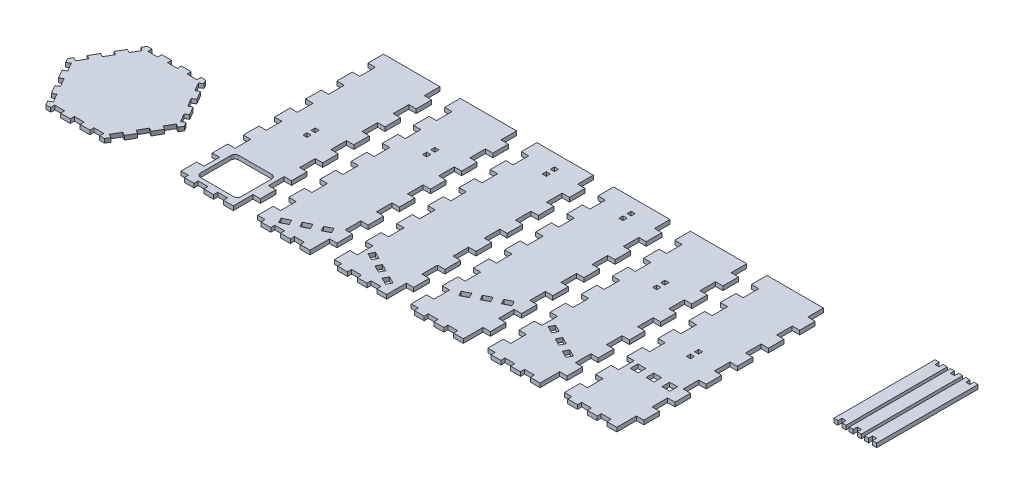
from build123d import *

# Parameters (mm, degrees)
BOSS_EXTRUDE3_DEPTH    = 3.2
SKETCH1_W              = 3.2
SKETCH1_H              = 3.2
BOSS_EXTRUDE3_2_DEPTH  = 3.2
BOSS_EXTRUDE3_3_DEPTH  = 3.2
BOSS_EXTRUDE3_4_DEPTH  = 3.2
BOSS_EXTRUDE3_5_DEPTH  = 3.2
BOSS_EXTRUDE3_6_DEPTH  = 3.2
SKETCH1_W_2            = 6.2
SKETCH1_H_2            = 6
BOSS_EXTRUDE3_7_DEPTH  = 3.2
BOSS_EXTRUDE3_8_DEPTH  = 3.2
BOSS_EXTRUDE3_9_DEPTH  = 3.2
BOSS_EXTRUDE3_10_DEPTH = 3.2


with BuildPart() as part:
    # Sketch1 → Boss-Extrude3 (new body)
    with BuildSketch(Plane(origin=(0, 0, 0), x_dir=(1, 0, 0), z_dir=(0, 1, 0))):
        Polygon((-22.869998863, -39.612), (-19.17495714, -39.612), (-19.17495714, -36.412), (-11.504974284, -36.412), (-11.504974284, -39.612), (-3.834991428, -39.612), (-3.834991428, -36.412), (3.834991428, -36.412), (3.834991428, -39.612), (11.504974284, -39.612), (11.504974284, -36.412), (19.17495714, -36.412), (19.17495714, -39.612), (22.869998863, -39.612), (24.717519725, -36.412), (21.946238432, -34.812), (25.781229861, -28.1696), (28.552511153, -29.7696), (32.387502581, -23.1272), (29.616221289, -21.5272), (33.451212717, -14.8848), (36.222494009, -16.4848), (40.057485437, -9.8424), (37.286204145, -8.2424), (41.121195573, -1.6), (43.892476865, -3.2), (45.739997726, 0), (43.892476865, 3.2), (41.121195573, 1.6), (37.286204145, 8.2424), (40.057485437, 9.8424), (36.222494009, 16.4848), (33.451212717, 14.8848), (29.616221289, 21.5272), (32.387502581, 23.1272), (28.552511153, 29.7696), (25.781229861, 28.1696), (21.946238432, 34.812), (24.717519725, 36.412), (22.869998863, 39.612), (19.17495714, 39.612), (19.17495714, 36.412), (11.504974284, 36.412), (11.504974284, 39.612), (3.834991428, 39.612), (3.834991428, 36.412), (-3.834991428, 36.412), (-3.834991428, 39.612), (-11.504974284, 39.612), (-11.504974284, 36.412), (-19.17495714, 36.412), (-19.17495714, 39.612), (-22.869998863, 39.612), (-24.717519725, 36.412), (-21.946238432, 34.812), (-25.781229861, 28.1696), (-28.552511153, 29.7696), (-32.387502581, 23.1272), (-29.616221289, 21.5272), (-33.451212717, 14.8848), (-36.222494009, 16.4848), (-40.057485437, 9.8424), (-37.286204145, 8.2424), (-41.121195573, 1.6), (-43.892476865, 3.2), (-45.739997726, 0), (-43.892476865, -3.2), (-41.121195573, -1.6), (-37.286204145, -8.2424), (-40.057485437, -9.8424), (-36.222494009, -16.4848), (-33.451212717, -14.8848), (-29.616221289, -21.5272), (-32.387502581, -23.1272), (-28.552511153, -29.7696), (-25.781229861, -28.1696), (-21.946238432, -34.812), (-24.717519725, -36.412), align=None)
    extrude(amount=BOSS_EXTRUDE3_DEPTH)


with BuildPart() as body_2:
    # Sketch1 → Boss-Extrude3 2 (new body)
    with BuildSketch(Plane(origin=(0, 0, 0), x_dir=(1, 0, 0), z_dir=(0, 1, 0))):
        Polygon((80.552757397, -34.879378177), (88.222740254, -34.879378177), (88.222740254, -31.679378177), (95.89272311, -31.679378177), (95.89272311, -34.879378177), (103.562705966, -34.879378177), (103.562705966, -31.679378177), (111.232688822, -31.679378177), (111.232688822, -34.879378177), (118.902671678, -34.879378177), (118.902671678, -19.491070485), (124.645234262, -19.491070485), (124.645234262, -7.302762793), (118.902671678, -7.302762793), (118.902671678, 4.8855449), (124.645234262, 4.8855449), (124.645234262, 17.073852592), (118.902671678, 17.073852592), (118.902671678, 29.262160284), (124.645234262, 29.262160284), (124.645234262, 41.450467977), (118.902671678, 41.450467977), (118.902671678, 53.638775669), (124.645234262, 53.638775669), (124.645234262, 65.827083361), (118.902671678, 65.827083361), (118.902671678, 78.015391054), (124.645234262, 78.015391054), (124.645234262, 90.203698746), (118.902671678, 90.203698746), (118.902671678, 102.392006438), (124.645234262, 102.392006438), (124.645234262, 114.58031413), (118.902671678, 114.58031413), (118.902671678, 126.768621823), (74.810194813, 126.768621823), (74.810194813, 114.58031413), (80.552757397, 114.58031413), (80.552757397, 102.392006438), (74.810194813, 102.392006438), (74.810194813, 90.203698746), (80.552757397, 90.203698746), (80.552757397, 78.015391054), (74.810194813, 78.015391054), (74.810194813, 65.827083361), (80.552757397, 65.827083361), (80.552757397, 53.638775669), (74.810194813, 53.638775669), (74.810194813, 41.450467977), (80.552757397, 41.450467977), (80.552757397, 29.262160284), (74.810194813, 29.262160284), (74.810194813, 17.073852592), (80.552757397, 17.073852592), (80.552757397, 4.8855449), (74.810194813, 4.8855449), (74.810194813, -7.302762793), (80.552757397, -7.302762793), (80.552757397, -19.491070485), (74.810194813, -19.491070485), (74.810194813, -31.679378177), (80.552757397, -31.679378177), align=None)
        with BuildLine():
            Line((86.752757397, 1.520621823), (112.702671678, 1.520621823))
            ThreePointArc((112.702671678, 1.520621823), (114.823992022, 0.641942166), (115.702671678, -1.479378177))
            Line((115.702671678, -1.479378177), (115.702671678, -25.479378177))
            ThreePointArc((115.702671678, -25.479378177), (114.823992022, -27.600698521), (112.702671678, -28.479378177))
            Line((112.702671678, -28.479378177), (86.752757397, -28.479378177))
            ThreePointArc((86.752757397, -28.479378177), (84.631437054, -27.600698521), (83.752757397, -25.479378177))
            Line((83.752757397, -25.479378177), (83.752757397, -1.479378177))
            ThreePointArc((83.752757397, -1.479378177), (84.631437054, 0.641942166), (86.752757397, 1.520621823))
        make_face(mode=Mode.SUBTRACT)
        with Locations((99.727714538, 41.960621823)):
            Rectangle(SKETCH1_W, SKETCH1_H, mode=Mode.SUBTRACT)
        with Locations((99.727714538, 48.360621823)):
            Rectangle(SKETCH1_W, SKETCH1_H, mode=Mode.SUBTRACT)
    extrude(amount=BOSS_EXTRUDE3_2_DEPTH)


with BuildPart() as body_3:
    # Sketch1 → Boss-Extrude3 3 (new body)
    with BuildSketch(Plane(origin=(0, 0, 0), x_dir=(1, 0, 0), z_dir=(0, 1, 0))):
        Polygon((140.552757397, -34.879378177), (148.222740254, -34.879378177), (148.222740254, -31.679378177), (155.89272311, -31.679378177), (155.89272311, -34.879378177), (163.562705966, -34.879378177), (163.562705966, -31.679378177), (171.232688822, -31.679378177), (171.232688822, -34.879378177), (178.902671678, -34.879378177), (178.902671678, -19.491070485), (184.645234262, -19.491070485), (184.645234262, -7.302762793), (178.902671678, -7.302762793), (178.902671678, 4.8855449), (184.645234262, 4.8855449), (184.645234262, 17.073852592), (178.902671678, 17.073852592), (178.902671678, 29.262160284), (184.645234262, 29.262160284), (184.645234262, 41.450467977), (178.902671678, 41.450467977), (178.902671678, 53.638775669), (184.645234262, 53.638775669), (184.645234262, 65.827083361), (178.902671678, 65.827083361), (178.902671678, 78.015391054), (184.645234262, 78.015391054), (184.645234262, 90.203698746), (178.902671678, 90.203698746), (178.902671678, 102.392006438), (184.645234262, 102.392006438), (184.645234262, 114.58031413), (178.902671678, 114.58031413), (178.902671678, 126.768621823), (134.810194813, 126.768621823), (134.810194813, 114.58031413), (140.552757397, 114.58031413), (140.552757397, 102.392006438), (134.810194813, 102.392006438), (134.810194813, 90.203698746), (140.552757397, 90.203698746), (140.552757397, 78.015391054), (134.810194813, 78.015391054), (134.810194813, 65.827083361), (140.552757397, 65.827083361), (140.552757397, 53.638775669), (134.810194813, 53.638775669), (134.810194813, 41.450467977), (140.552757397, 41.450467977), (140.552757397, 29.262160284), (134.810194813, 29.262160284), (134.810194813, 17.073852592), (140.552757397, 17.073852592), (140.552757397, 4.8855449), (134.810194813, 4.8855449), (134.810194813, -7.302762793), (140.552757397, -7.302762793), (140.552757397, -19.491070485), (134.810194813, -19.491070485), (134.810194813, -31.679378177), (140.552757397, -31.679378177), align=None)
        Polygon((145.863459219, -24.522323794), (151.409161346, -21.750106647), (153.376541257, -25.685766221), (147.83083913, -28.457983368), align=None, mode=Mode.SUBTRACT)
        Polygon((156.954863474, -18.977889499), (162.500565602, -16.205672352), (164.467945513, -20.141331927), (158.922243385, -22.913549074), align=None, mode=Mode.SUBTRACT)
        Polygon((168.046267729, -13.433455205), (173.591969857, -10.661238058), (175.559349768, -14.596897632), (170.01364764, -17.369114779), align=None, mode=Mode.SUBTRACT)
        with Locations((159.727714538, 75.560621823)):
            Rectangle(SKETCH1_W, SKETCH1_H, mode=Mode.SUBTRACT)
        with Locations((159.727714538, 81.960621823)):
            Rectangle(SKETCH1_W, SKETCH1_H, mode=Mode.SUBTRACT)
    extrude(amount=BOSS_EXTRUDE3_3_DEPTH)


with BuildPart() as body_4:
    # Sketch1 → Boss-Extrude3 4 (new body)
    with BuildSketch(Plane(origin=(0, 0, 0), x_dir=(1, 0, 0), z_dir=(0, 1, 0))):
        Polygon((200.552757397, -34.879378177), (208.222740254, -34.879378177), (208.222740254, -31.679378177), (215.89272311, -31.679378177), (215.89272311, -34.879378177), (223.562705966, -34.879378177), (223.562705966, -31.679378177), (231.232688822, -31.679378177), (231.232688822, -34.879378177), (238.902671678, -34.879378177), (238.902671678, -19.491070485), (244.645234262, -19.491070485), (244.645234262, -7.302762793), (238.902671678, -7.302762793), (238.902671678, 4.8855449), (244.645234262, 4.8855449), (244.645234262, 17.073852592), (238.902671678, 17.073852592), (238.902671678, 29.262160284), (244.645234262, 29.262160284), (244.645234262, 41.450467977), (238.902671678, 41.450467977), (238.902671678, 53.638775669), (244.645234262, 53.638775669), (244.645234262, 65.827083361), (238.902671678, 65.827083361), (238.902671678, 78.015391054), (244.645234262, 78.015391054), (244.645234262, 90.203698746), (238.902671678, 90.203698746), (238.902671678, 102.392006438), (244.645234262, 102.392006438), (244.645234262, 114.58031413), (238.902671678, 114.58031413), (238.902671678, 126.768621823), (194.810194813, 126.768621823), (194.810194813, 114.58031413), (200.552757397, 114.58031413), (200.552757397, 102.392006438), (194.810194813, 102.392006438), (194.810194813, 90.203698746), (200.552757397, 90.203698746), (200.552757397, 78.015391054), (194.810194813, 78.015391054), (194.810194813, 65.827083361), (200.552757397, 65.827083361), (200.552757397, 53.638775669), (194.810194813, 53.638775669), (194.810194813, 41.450467977), (200.552757397, 41.450467977), (200.552757397, 29.262160284), (194.810194813, 29.262160284), (194.810194813, 17.073852592), (200.552757397, 17.073852592), (200.552757397, 4.8855449), (194.810194813, 4.8855449), (194.810194813, -7.302762793), (200.552757397, -7.302762793), (200.552757397, -19.491070485), (194.810194813, -19.491070485), (194.810194813, -31.679378177), (200.552757397, -31.679378177), align=None)
        Polygon((205.863459219, -10.661238058), (203.896079308, -14.596897632), (209.441781435, -17.369114779), (211.409161346, -13.433455205), align=None, mode=Mode.SUBTRACT)
        Polygon((216.954863474, -16.205672352), (214.987483563, -20.141331927), (220.533185691, -22.913549074), (222.500565602, -18.977889499), align=None, mode=Mode.SUBTRACT)
        Polygon((228.046267729, -21.750106647), (226.078887818, -25.685766221), (231.624589946, -28.457983368), (233.591969857, -24.522323794), align=None, mode=Mode.SUBTRACT)
        with Locations((219.727714538, 109.160621823)):
            Rectangle(SKETCH1_W, SKETCH1_H, mode=Mode.SUBTRACT)
        with Locations((219.727714538, 115.560621823)):
            Rectangle(SKETCH1_W, SKETCH1_H, mode=Mode.SUBTRACT)
    extrude(amount=BOSS_EXTRUDE3_4_DEPTH)


with BuildPart() as body_5:
    # Sketch1 → Boss-Extrude3 5 (new body)
    with BuildSketch(Plane(origin=(0, 0, 0), x_dir=(1, 0, 0), z_dir=(0, 1, 0))):
        Polygon((260.552757397, -34.879378177), (268.222740254, -34.879378177), (268.222740254, -31.679378177), (275.89272311, -31.679378177), (275.89272311, -34.879378177), (283.562705966, -34.879378177), (283.562705966, -31.679378177), (291.232688822, -31.679378177), (291.232688822, -34.879378177), (298.902671678, -34.879378177), (298.902671678, -19.491070485), (304.645234262, -19.491070485), (304.645234262, -7.302762793), (298.902671678, -7.302762793), (298.902671678, 4.8855449), (304.645234262, 4.8855449), (304.645234262, 17.073852592), (298.902671678, 17.073852592), (298.902671678, 29.262160284), (304.645234262, 29.262160284), (304.645234262, 41.450467977), (298.902671678, 41.450467977), (298.902671678, 53.638775669), (304.645234262, 53.638775669), (304.645234262, 65.827083361), (298.902671678, 65.827083361), (298.902671678, 78.015391054), (304.645234262, 78.015391054), (304.645234262, 90.203698746), (298.902671678, 90.203698746), (298.902671678, 102.392006438), (304.645234262, 102.392006438), (304.645234262, 114.58031413), (298.902671678, 114.58031413), (298.902671678, 126.768621823), (254.810194813, 126.768621823), (254.810194813, 114.58031413), (260.552757397, 114.58031413), (260.552757397, 102.392006438), (254.810194813, 102.392006438), (254.810194813, 90.203698746), (260.552757397, 90.203698746), (260.552757397, 78.015391054), (254.810194813, 78.015391054), (254.810194813, 65.827083361), (260.552757397, 65.827083361), (260.552757397, 53.638775669), (254.810194813, 53.638775669), (254.810194813, 41.450467977), (260.552757397, 41.450467977), (260.552757397, 29.262160284), (254.810194813, 29.262160284), (254.810194813, 17.073852592), (260.552757397, 17.073852592), (260.552757397, 4.8855449), (254.810194813, 4.8855449), (254.810194813, -7.302762793), (260.552757397, -7.302762793), (260.552757397, -19.491070485), (254.810194813, -19.491070485), (254.810194813, -31.679378177), (260.552757397, -31.679378177), align=None)
        Polygon((267.83083913, -7.437983368), (265.863459219, -3.502323794), (271.409161346, -0.730106647), (273.376541257, -4.665766221), align=None, mode=Mode.SUBTRACT)
        Polygon((276.954863474, 2.042110501), (278.922243385, -1.893549074), (284.467945513, 0.878668073), (282.500565602, 4.814327648), align=None, mode=Mode.SUBTRACT)
        Polygon((288.046267729, 7.586544795), (290.01364764, 3.650885221), (295.559349768, 6.423102368), (293.591969857, 10.358761942), align=None, mode=Mode.SUBTRACT)
        with Locations((279.727714538, 115.560621823)):
            Rectangle(SKETCH1_W, SKETCH1_H, mode=Mode.SUBTRACT)
        with Locations((279.727714538, 109.160621823)):
            Rectangle(SKETCH1_W, SKETCH1_H, mode=Mode.SUBTRACT)
    extrude(amount=BOSS_EXTRUDE3_5_DEPTH)


with BuildPart() as body_6:
    # Sketch1 → Boss-Extrude3 6 (new body)
    with BuildSketch(Plane(origin=(0, 0, 0), x_dir=(1, 0, 0), z_dir=(0, 1, 0))):
        Polygon((320.552757397, -34.879378177), (328.222740254, -34.879378177), (328.222740254, -31.679378177), (335.89272311, -31.679378177), (335.89272311, -34.879378177), (343.562705966, -34.879378177), (343.562705966, -31.679378177), (351.232688822, -31.679378177), (351.232688822, -34.879378177), (358.902671678, -34.879378177), (358.902671678, -19.491070485), (364.645234262, -19.491070485), (364.645234262, -7.302762793), (358.902671678, -7.302762793), (358.902671678, 4.8855449), (364.645234262, 4.8855449), (364.645234262, 17.073852592), (358.902671678, 17.073852592), (358.902671678, 29.262160284), (364.645234262, 29.262160284), (364.645234262, 41.450467977), (358.902671678, 41.450467977), (358.902671678, 53.638775669), (364.645234262, 53.638775669), (364.645234262, 65.827083361), (358.902671678, 65.827083361), (358.902671678, 78.015391054), (364.645234262, 78.015391054), (364.645234262, 90.203698746), (358.902671678, 90.203698746), (358.902671678, 102.392006438), (364.645234262, 102.392006438), (364.645234262, 114.58031413), (358.902671678, 114.58031413), (358.902671678, 126.768621823), (314.810194813, 126.768621823), (314.810194813, 114.58031413), (320.552757397, 114.58031413), (320.552757397, 102.392006438), (314.810194813, 102.392006438), (314.810194813, 90.203698746), (320.552757397, 90.203698746), (320.552757397, 78.015391054), (314.810194813, 78.015391054), (314.810194813, 65.827083361), (320.552757397, 65.827083361), (320.552757397, 53.638775669), (314.810194813, 53.638775669), (314.810194813, 41.450467977), (320.552757397, 41.450467977), (320.552757397, 29.262160284), (314.810194813, 29.262160284), (314.810194813, 17.073852592), (320.552757397, 17.073852592), (320.552757397, 4.8855449), (314.810194813, 4.8855449), (314.810194813, -7.302762793), (320.552757397, -7.302762793), (320.552757397, -19.491070485), (314.810194813, -19.491070485), (314.810194813, -31.679378177), (320.552757397, -31.679378177), align=None)
        Polygon((325.863459219, 10.358761942), (331.409161346, 7.586544795), (329.441781435, 3.650885221), (323.896079308, 6.423102368), align=None, mode=Mode.SUBTRACT)
        Polygon((336.954863474, 4.814327648), (342.500565602, 2.042110501), (340.533185691, -1.893549074), (334.987483563, 0.878668073), align=None, mode=Mode.SUBTRACT)
        Polygon((346.078887818, -4.665766221), (351.624589946, -7.437983368), (353.591969857, -3.502323794), (348.046267729, -0.730106647), align=None, mode=Mode.SUBTRACT)
        with Locations((339.727714538, 81.960621823)):
            Rectangle(SKETCH1_W, SKETCH1_H, mode=Mode.SUBTRACT)
        with Locations((339.727714538, 75.560621823)):
            Rectangle(SKETCH1_W, SKETCH1_H, mode=Mode.SUBTRACT)
    extrude(amount=BOSS_EXTRUDE3_6_DEPTH)


with BuildPart() as body_7:
    # Sketch1 → Boss-Extrude3 7 (new body)
    with BuildSketch(Plane(origin=(0, 0, 0), x_dir=(1, 0, 0), z_dir=(0, 1, 0))):
        Polygon((380.552757397, -34.879378177), (388.222740254, -34.879378177), (388.222740254, -31.679378177), (395.89272311, -31.679378177), (395.89272311, -34.879378177), (403.562705966, -34.879378177), (403.562705966, -31.679378177), (411.232688822, -31.679378177), (411.232688822, -34.879378177), (418.902671678, -34.879378177), (418.902671678, -19.491070485), (424.645234262, -19.491070485), (424.645234262, -7.302762793), (418.902671678, -7.302762793), (418.902671678, 4.8855449), (424.645234262, 4.8855449), (424.645234262, 17.073852592), (418.902671678, 17.073852592), (418.902671678, 29.262160284), (424.645234262, 29.262160284), (424.645234262, 41.450467977), (418.902671678, 41.450467977), (418.902671678, 53.638775669), (424.645234262, 53.638775669), (424.645234262, 65.827083361), (418.902671678, 65.827083361), (418.902671678, 78.015391054), (424.645234262, 78.015391054), (424.645234262, 90.203698746), (418.902671678, 90.203698746), (418.902671678, 102.392006438), (424.645234262, 102.392006438), (424.645234262, 114.58031413), (418.902671678, 114.58031413), (418.902671678, 126.768621823), (374.810194813, 126.768621823), (374.810194813, 114.58031413), (380.552757397, 114.58031413), (380.552757397, 102.392006438), (374.810194813, 102.392006438), (374.810194813, 90.203698746), (380.552757397, 90.203698746), (380.552757397, 78.015391054), (374.810194813, 78.015391054), (374.810194813, 65.827083361), (380.552757397, 65.827083361), (380.552757397, 53.638775669), (374.810194813, 53.638775669), (374.810194813, 41.450467977), (380.552757397, 41.450467977), (380.552757397, 29.262160284), (374.810194813, 29.262160284), (374.810194813, 17.073852592), (380.552757397, 17.073852592), (380.552757397, 4.8855449), (374.810194813, 4.8855449), (374.810194813, -7.302762793), (380.552757397, -7.302762793), (380.552757397, -19.491070485), (374.810194813, -19.491070485), (374.810194813, -31.679378177), (380.552757397, -31.679378177), align=None)
        with Locations((387.327714538, 13.360621823)):
            Rectangle(SKETCH1_W_2, SKETCH1_H_2, mode=Mode.SUBTRACT)
        with Locations((399.727714538, 13.360621823)):
            Rectangle(SKETCH1_W_2, SKETCH1_H_2, mode=Mode.SUBTRACT)
        with Locations((412.127714538, 13.360621823)):
            Rectangle(SKETCH1_W_2, SKETCH1_H_2, mode=Mode.SUBTRACT)
        with Locations((399.727714538, 48.360621823)):
            Rectangle(SKETCH1_W, SKETCH1_H, mode=Mode.SUBTRACT)
        with Locations((399.727714538, 41.960621823)):
            Rectangle(SKETCH1_W, SKETCH1_H, mode=Mode.SUBTRACT)
    extrude(amount=BOSS_EXTRUDE3_7_DEPTH)


with BuildPart() as body_8:
    # Sketch1 → Boss-Extrude3 8 (new body)
    with BuildSketch(Plane(origin=(0, 0, 0), x_dir=(1, 0, 0), z_dir=(0, 1, 0))):
        Polygon((497.6107333, 135.403791421), (497.6107333, 56.183791421), (500.8107333, 56.183791421), (500.8107333, 59.383791421), (504.0107333, 59.383791421), (504.0107333, 56.183791421), (507.2107333, 56.183791421), (507.2107333, 135.403791421), (504.0107333, 135.403791421), (504.0107333, 132.203791421), (500.8107333, 132.203791421), (500.8107333, 135.403791421), align=None)
    extrude(amount=BOSS_EXTRUDE3_8_DEPTH)


with BuildPart() as body_9:
    # Sketch1 → Boss-Extrude3 9 (new body)
    with BuildSketch(Plane(origin=(0, 0, 0), x_dir=(1, 0, 0), z_dir=(0, 1, 0))):
        Polygon((509.6107333, 135.403791421), (509.6107333, 56.183791421), (512.8107333, 56.183791421), (512.8107333, 59.383791421), (516.0107333, 59.383791421), (516.0107333, 56.183791421), (519.2107333, 56.183791421), (519.2107333, 135.403791421), (516.0107333, 135.403791421), (516.0107333, 132.203791421), (512.8107333, 132.203791421), (512.8107333, 135.403791421), align=None)
    extrude(amount=BOSS_EXTRUDE3_9_DEPTH)


with BuildPart() as body_10:
    # Sketch1 → Boss-Extrude3 10 (new body)
    with BuildSketch(Plane(origin=(0, 0, 0), x_dir=(1, 0, 0), z_dir=(0, 1, 0))):
        Polygon((521.6107333, 135.403791421), (521.6107333, 56.183791421), (524.8107333, 56.183791421), (524.8107333, 59.383791421), (528.0107333, 59.383791421), (528.0107333, 56.183791421), (531.2107333, 56.183791421), (531.2107333, 135.403791421), (528.0107333, 135.403791421), (528.0107333, 132.203791421), (524.8107333, 132.203791421), (524.8107333, 135.403791421), align=None)
    extrude(amount=BOSS_EXTRUDE3_10_DEPTH)


solid = Compound([part.part, body_2.part, body_3.part, body_4.part, body_5.part, body_6.part, body_7.part, body_8.part, body_9.part, body_10.part])
